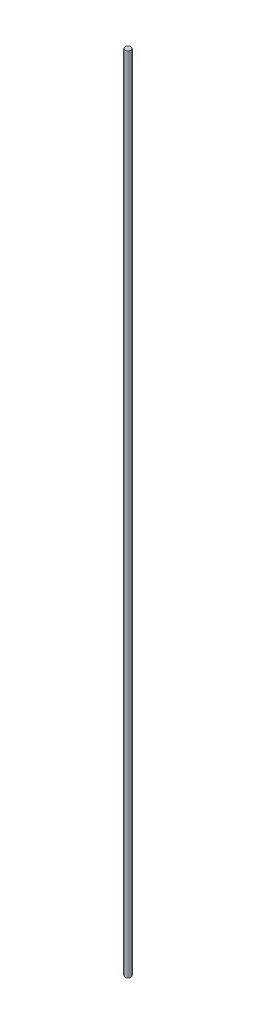
from build123d import *

# Parameters (mm, degrees)
SKETCH1_R           = 3
BOSS_EXTRUDE1_DEPTH = 800


with BuildPart() as part:
    # Sketch1 → Boss-Extrude1 (new body)
    with BuildSketch(Plane(origin=(0, 0, 0), x_dir=(1, 0, 0), z_dir=(0, 1, 0))):
        Circle(SKETCH1_R)
    extrude(amount=BOSS_EXTRUDE1_DEPTH)


solid = part.part
